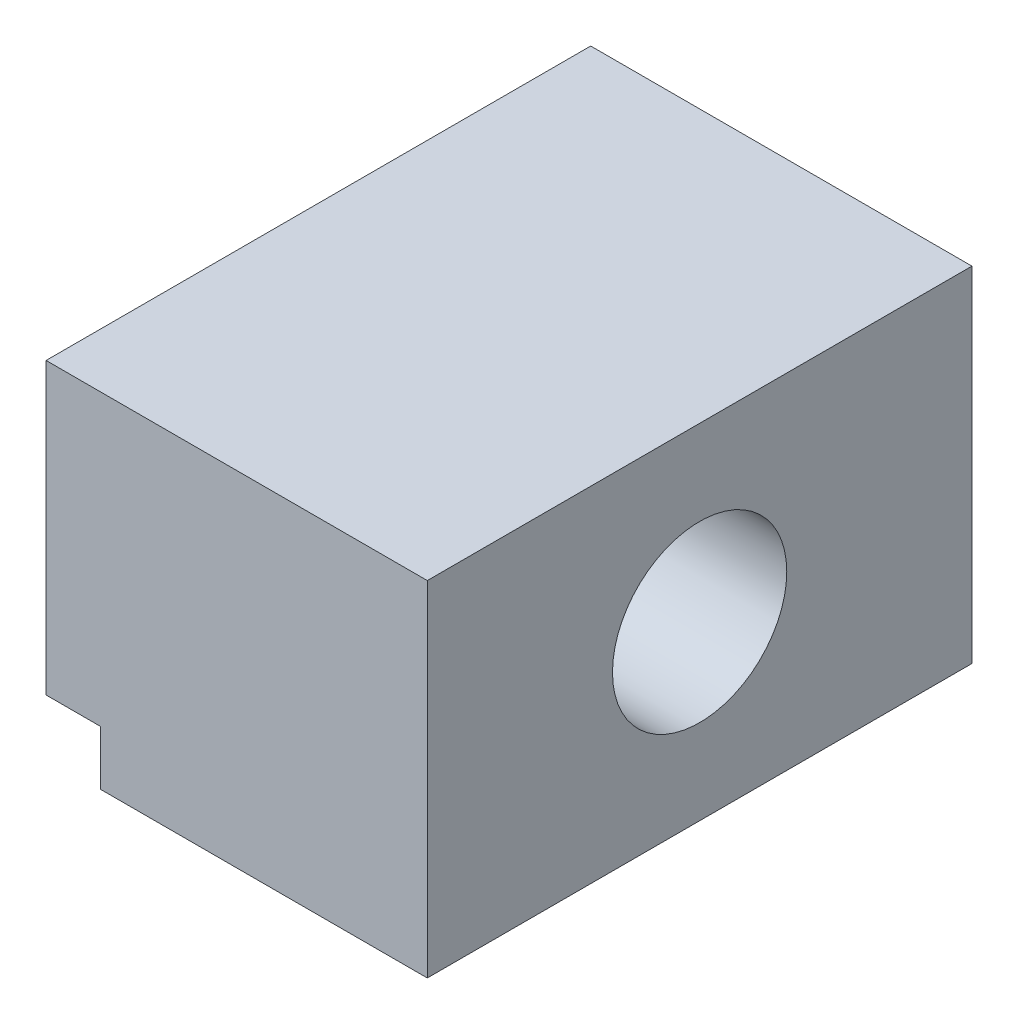
from build123d import *

# Parameters (mm, degrees)
SKETCH1_W               = 6
SKETCH1_H               = 5
BOSS_EXTRUDE1_DEPTH     = 0.5
SKETCH2_W               = 7
SKETCH2_H               = 5
BOSS_EXTRUDE2_DEPTH     = 2.66
SKETCH3_R               = 0.8
CUT_EXTRUDE1_DEPTH      = 9.076855824
CHAMFER1_SIZE           = 0.5
CUT_EXTRUDE2_DEPTH      = 6.337190272
CUT_EXTRUDE2_DEPTH_BACK = 6.337190272
SKETCH4_W               = 3.5
SKETCH4_H               = 5


with BuildPart() as part:
    # Sketch1 → Boss-Extrude1 (new body)
    with BuildSketch(Plane(origin=(0, 0, 0), x_dir=(1, 0, 0), z_dir=(0, 1, 0))):
        Rectangle(SKETCH1_W, SKETCH1_H)
    extrude(amount=BOSS_EXTRUDE1_DEPTH)

    # Sketch2 → Boss-Extrude2 (add)
    with BuildSketch(Plane(origin=(0, 0.5, 0), x_dir=(1, 0, 0), z_dir=(0, 1, 0))):
        Rectangle(SKETCH2_W, SKETCH2_H)
    extrude(amount=BOSS_EXTRUDE2_DEPTH)

    # Sketch3 → Cut-Extrude1 (cut, through all)
    with BuildSketch(Plane.ZY.offset(3.5)):
        with Locations((0, 1.58)):
            Circle(SKETCH3_R)
    extrude(amount=-CUT_EXTRUDE1_DEPTH, mode=Mode.SUBTRACT)

    # Chamfer1
    # the kernel refuses this chamfer: 0.5 mm, written as the material it takes off along each edge
    with BuildSketch(Plane(origin=(3.5, 1.58, 0), x_dir=(0, 0, 1), z_dir=(0, -1, 0))) as chamfer1_piece_1:
        Polygon((0.8 + CHAMFER1_SIZE, 0), (0.8, CHAMFER1_SIZE), (0.8, 0), align=None)
    revolve(axis=Axis((3.5, 1.58, 0), (-1, 0, 0)), mode=Mode.SUBTRACT)
    with BuildSketch(Plane(origin=(-3.5, 1.58, 0), x_dir=(0, 0, 1), z_dir=(0, -1, 0))) as chamfer1_piece_2:
        Polygon((0.8 + CHAMFER1_SIZE, 0), (0.8, -CHAMFER1_SIZE), (0.8, 0), align=None)
    revolve(axis=Axis((-3.5, 1.58, 0), (-1, 0, 0)), mode=Mode.SUBTRACT)

    # Sketch4 → Cut-Extrude2 (cut, two sides: drawn at the far end of the back side and taken through both)
    with BuildSketch(Plane(origin=(0, 3.16, 0), x_dir=(1, 0, 0), z_dir=(0, 1, 0)).offset(-CUT_EXTRUDE2_DEPTH_BACK)):
        with Locations((1.75, 0)):
            Rectangle(SKETCH4_W, SKETCH4_H)
    extrude(amount=CUT_EXTRUDE2_DEPTH + CUT_EXTRUDE2_DEPTH_BACK, mode=Mode.SUBTRACT)


solid = part.part
